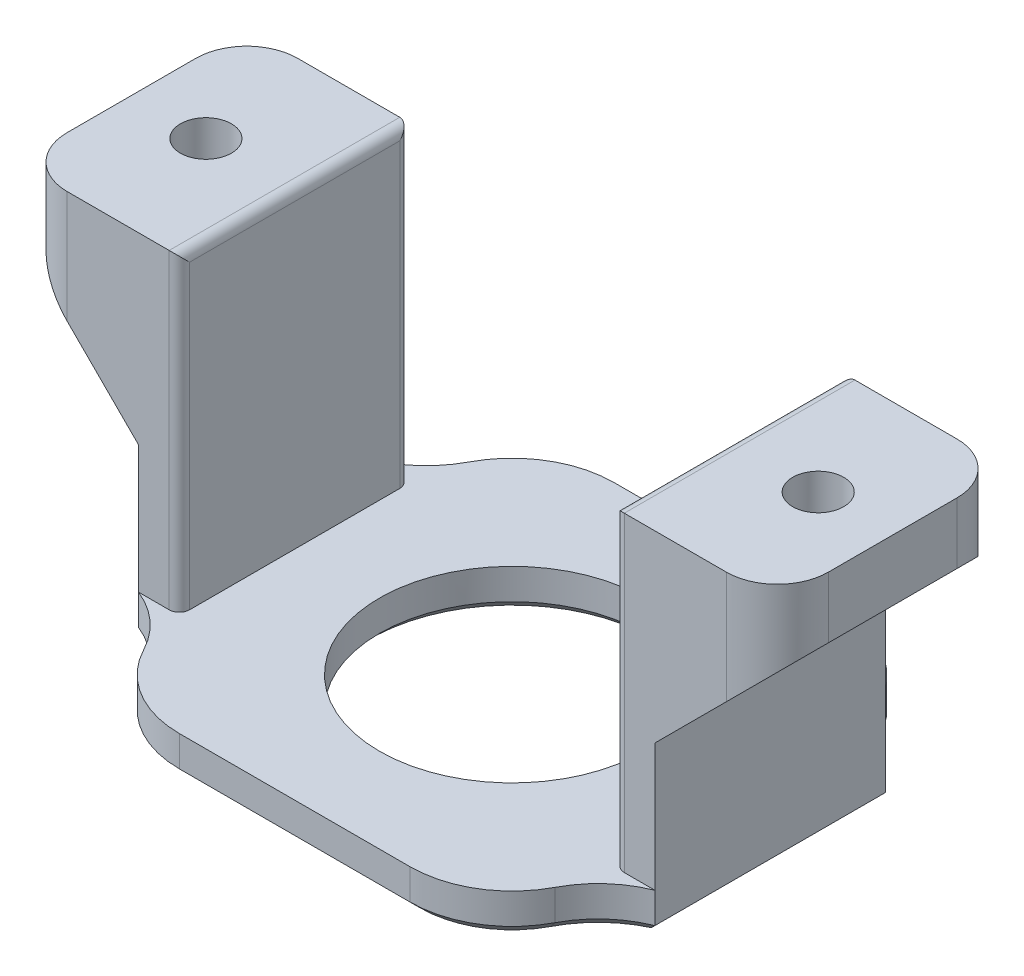
from build123d import *

# Parameters (mm, degrees)
SKETCH_1_W            = 42.6
SKETCH_1_H            = 42.6
EXTRUDE_1_DEPTH       = 4
SKETCH_2_R            = 13
CUT_EXTRUDE_1_DEPTH   = 6
FILLET_1_R            = 10
SKETCH_3_W            = 4
SKETCH_3_H            = 22.6
EXTRUDE_2_DEPTH       = 34.5
FILLET_2_R            = 10
SKETCH_4_W            = 12
SKETCH_4_H            = 22.6
EXTRUDE_3_DEPTH       = 6
FILLET_3_R            = 5
FILLET_4_R            = 1
CHAMFER_3_SIZE        = 1
SKETCH_5_R            = 2.5
CUT_EXTRUDE_2_DEPTH   = 56.092921505
CHAMFER_START         = -9.101924
CHAMFER_4_DEPTH       = 6.602294476
CHAMFER_START_2       = 2.5000001
CHAMFER_4_2_DEPTH     = 6.6019239
CHAMFER_START_3       = -2.499629524
CHAMFER_4_3_DEPTH     = 4.999629624
CHAMFER_START_4       = -11.3
CHAMFER_4_4_DEPTH     = 2.198076
CHAMFER_START_5       = 9.101924
CHAMFER_4_5_DEPTH     = 2.198076
CHAMFER_START_6       = 16.5
CHAMFER_4_6_OUTLINE_R = 2.5
CHAMFER_4_6_DEPTH     = 12
SKETCH_6_R            = 4.2
CUT_EXTRUDE_5_DEPTH   = 28


with BuildPart() as part:
    # Эскиз1 → Бобышка-Вытянуть1 (new body)
    with BuildSketch(Plane(origin=(0, 0, 0), x_dir=(1, 0, 0), z_dir=(0, 1, 0))):
        Rectangle(SKETCH_1_W, SKETCH_1_H)
    extrude(amount=EXTRUDE_1_DEPTH)

    # Эскиз2 → Вырез-Вытянуть1 (cut)
    with BuildSketch(Plane(origin=(0, 4, 0), x_dir=(1, 0, 0), z_dir=(0, 1, 0))):
        with Locations(Location((0, 0, 0), (0, 0, 270))):
            Circle(SKETCH_2_R)
    extrude(amount=-CUT_EXTRUDE_1_DEPTH, mode=Mode.SUBTRACT)

    # Скругление1
    fillet_1_edges = [part.edges().sort_by_distance(p)[0] for p in [
        (21.3, 2, 21.3),
        (-21.3, 2, 21.3),
        (-21.3, 2, -21.3),
        (21.3, 2, -21.3),
    ]]
    fillet(fillet_1_edges, radius=FILLET_1_R)

    # Эскиз3 → Бобышка-Вытянуть2 (add)
    with BuildSketch(Plane(origin=(0, 0, 0), x_dir=(1, 0, 0), z_dir=(0, 1, 0))):
        with Locations((-23.3, 0)):
            Rectangle(SKETCH_3_W, SKETCH_3_H)
        with Locations((23.3, 0)):
            Rectangle(SKETCH_3_W, SKETCH_3_H)
    extrude(amount=EXTRUDE_2_DEPTH)

    # Скругление2
    # the kernel refuses this fillet: 10 mm, written as the material it adds along each edge
    with BuildSketch(Plane(origin=(21.3, 0, -11.3), x_dir=(-0.23904572186687842, 0, -0.9710083124552246), z_dir=(0, 1, 0)), Plane(origin=(-21.3, 0, 11.3), x_dir=(0.2390457218668792, 0, 0.9710083124552243), z_dir=(0, 1, 0))) as fillet_2_piece_1:
        with BuildLine():
            CenterArc((7.171371656, -9.710083125), FILLET_2_R, 103.83022495, 40.535802111)
            Line((-0.956182887, -3.88403325), (0, 0))
            ThreePointArc((0, 0), (2.390457219, -0.289916875), (4.780914437, 0))
        make_face()
    extrude(amount=4)
    with BuildSketch(Plane(origin=(-21.3, 0, -11.3), x_dir=(0.23904572186687842, 0, -0.9710083124552246), z_dir=(0, 1, 0)), Plane(origin=(21.3, 0, 11.3), x_dir=(-0.2390457218668792, 0, 0.9710083124552243), z_dir=(0, 1, 0))) as fillet_2_piece_2:
        with BuildLine():
            CenterArc((7.171371656, 9.710083125), FILLET_2_R, 215.633972939, 40.535802111)
            Line((-0.956182887, 3.88403325), (0, 0))
            ThreePointArc((0, 0), (2.390457219, 0.289916875), (4.780914437, 0))
        make_face()
    extrude(amount=4)

    # Эскиз4 → Бобышка-Вытянуть3 (add)
    with BuildSketch(Plane(origin=(0, 34.5, 0), x_dir=(1, 0, 0), z_dir=(0, 1, 0))):
        with Locations((-31.3, 0)):
            Rectangle(SKETCH_4_W, SKETCH_4_H)
        with Locations((31.3, 0)):
            Rectangle(SKETCH_4_W, SKETCH_4_H)
    extrude(amount=-EXTRUDE_3_DEPTH)

    # Скругление3
    fillet_3_edges = [part.edges().sort_by_distance(p)[0] for p in [
        (37.3, 31.5, -11.3),
        (37.3, 31.5, 11.3),
        (-37.3, 31.5, 11.3),
        (-37.3, 31.5, -11.3),
    ]]
    fillet(fillet_3_edges, radius=FILLET_3_R)

    # Скругление4
    fillet_4_edges = [part.edges().sort_by_distance(p)[0] for p in [
        (21.3, 19.25, -11.3),
        (21.3, 19.25, 11.3),
        (21.3, 34.5, 0),
        (-21.3, 19.25, 11.3),
        (-21.3, 19.25, -11.3),
        (-21.3, 34.5, 0),
    ]]
    fillet(fillet_4_edges, radius=FILLET_4_R)

    # Фаска3
    chamfer_3_edges = [part.edges().sort_by_distance(p)[0] for p in [
        (0, 0, -13),
        (0, 0, 21.3),
        (0, 0, -21.3),
        (16.475757114, 0, -19.856374133),
        (-16.475757114, 0, 19.856374133),
        (25.3, 0, 0),
        (-25.3, 0, 0),
        (-16.475757114, 0, -19.856374133),
        (16.475757114, 0, 19.856374133),
        (22.313691772, 0, -13.16154043),
        (-22.313691772, 0, -13.16154043),
        (-22.313691772, 0, 13.16154043),
        (22.313691772, 0, 13.16154043),
    ]]
    chamfer(chamfer_3_edges, length=CHAMFER_3_SIZE)

    # Эскиз5 → Вырез-Вытянуть2 (cut, through all)
    with BuildSketch(Plane(origin=(0, 34.5, 0), x_dir=(1, 0, 0), z_dir=(0, 1, 0))):
        with Locations(Location((30, 0, 0), (0, 0, 270))):
            Circle(SKETCH_5_R)
        with Locations(Location((-30, 0, 0), (0, 0, 90))):
            Circle(SKETCH_5_R)
    extrude(amount=-CUT_EXTRUDE_2_DEPTH, mode=Mode.SUBTRACT)

    # Фаска4: read off the stored shape, not the designer's step
    # Фаска4 outline → Фаска4 (add)
    with BuildSketch(Plane.XY.offset(CHAMFER_START)):
        Polygon((-37.3, 28.5), (-25.3, 16.5), (-25.3, 28.5), align=None)
        Polygon((25.3, 28.5), (25.3, 16.5), (37.3, 28.5), align=None)
    extrude(amount=CHAMFER_4_DEPTH)

    # Chamfer 4 2 outline → Chamfer 4 2 (add)
    with BuildSketch(Plane.XY.offset(CHAMFER_START_2)):
        Polygon((-37.3, 28.5), (-25.3, 16.5), (-25.3, 28.5), align=None)
        Polygon((25.3, 28.5), (25.3, 16.5), (37.3, 28.5), align=None)
    extrude(amount=CHAMFER_4_2_DEPTH)

    # Chamfer 4 3 outline → Chamfer 4 3 (add)
    with BuildSketch(Plane.XY.offset(CHAMFER_START_3)):
        Polygon((-37.3, 28.5), (-25.3, 16.5), (-25.3, 28.5), align=None)
        Polygon((25.3, 28.5), (25.3, 16.5), (37.3, 28.5), align=None)
    extrude(amount=CHAMFER_4_3_DEPTH)

    # Chamfer 4 4 outline → Chamfer 4 4 (add)
    with BuildSketch(Plane.XY.offset(CHAMFER_START_4)):
        Polygon((-37.3, 28.5), (-25.3, 16.5), (-25.3, 28.5), align=None)
        Polygon((25.3, 28.5), (25.3, 16.5), (37.3, 28.5), align=None)
    extrude(amount=CHAMFER_4_4_DEPTH)

    # Chamfer 4 5 outline → Chamfer 4 5 (add)
    with BuildSketch(Plane.XY.offset(CHAMFER_START_5)):
        Polygon((-37.3, 28.5), (-25.3, 16.5), (-25.3, 28.5), align=None)
        Polygon((25.3, 28.5), (25.3, 16.5), (37.3, 28.5), align=None)
    extrude(amount=CHAMFER_4_5_DEPTH)

    # Chamfer 4 6 outline → Chamfer 4 6 (cut)
    with BuildSketch(Plane(origin=(0, 0, 0), x_dir=(1, 0, 0), z_dir=(0, 1, 0)).offset(CHAMFER_START_6)):
        with BuildLine():
            Line((37.299999999, -11.3), (37.3, -6.3))
            ThreePointArc((37.3, -6.3), (35.835533906, -9.835533906), (32.3, -11.3))
            Line((32.3, -11.3), (37.299999999, -11.3))
        make_face()
        with BuildLine():
            ThreePointArc((32.3, 11.3), (35.835533906, 9.835533906), (37.3, 6.3))
            Line((37.3, 6.3), (37.299999999, 11.3))
            Line((37.299999999, 11.3), (32.3, 11.3))
        make_face()
        with BuildLine():
            Line((-37.3, -11.3), (-32.3, -11.3))
            ThreePointArc((-32.3, -11.3), (-35.835533906, -9.835533906), (-37.3, -6.3))
            Line((-37.3, -6.3), (-37.3, -11.3))
        make_face()
        with BuildLine():
            ThreePointArc((-37.3, 6.3), (-35.835533906, 9.835533906), (-32.3, 11.3))
            Line((-32.3, 11.3), (-37.3, 11.3))
            Line((-37.3, 11.3), (-37.3, 6.3))
        make_face()
        with Locations((-30, 0)):
            Circle(CHAMFER_4_6_OUTLINE_R)
        with Locations((30, 0)):
            Circle(CHAMFER_4_6_OUTLINE_R)
    extrude(amount=CHAMFER_4_6_DEPTH, mode=Mode.SUBTRACT)

    # Эскиз6 → Вырез-Вытянуть5 (cut)
    with BuildSketch(Plane.XZ):
        with Locations(Location((30, 0, 0), (0, 0, 270))):
            Circle(SKETCH_6_R)
        with Locations((-30, 0)):
            Circle(SKETCH_6_R)
    extrude(amount=-CUT_EXTRUDE_5_DEPTH, mode=Mode.SUBTRACT)

    # Фаска5
    # the kernel refuses this chamfer: 2 mm, written as the material it takes off along each edge
    with BuildSketch(Plane(origin=(30, 28, 0), x_dir=(1, 0, 0), z_dir=(0, 0, -1))) as chamfer_5_piece_1_section:
        with BuildLine():
            Line((4.556568542, 0.056568542), (2.443431458, -2.056568542))
            Line((2.443431458, -2.056568542), (2.403431458, -2.056568542))
            ThreePointArc((2.403431458, -2.056568542), (2.46, -1.028284271), (2.46, 0))
            Line((2.46, 0), (2.5, 0.04))
            ThreePointArc((2.5, 0.04), (3.528284271, 0.04), (4.556568542, 0.096568542))
            Line((4.556568542, 0.096568542), (4.556568542, 0.056568542))
        make_face()
    chamfer_5_piece_1 = revolve(axis=Axis((30, 28, 0), (0, -1, 0)), mode=Mode.PRIVATE)
    chamfer_5_piece_1 = chamfer_5_piece_1 & Plane(origin=(30, 28, 0), x_dir=(0, 0, -1), z_dir=(0, -1, 0)) * Cylinder(4.2, 19, mode=Mode.PRIVATE)
    add(chamfer_5_piece_1, mode=Mode.SUBTRACT)
    with BuildSketch(Plane(origin=(-30, 28, 0), x_dir=(1, 0, 0), z_dir=(0, 0, -1))) as chamfer_5_piece_2_section:
        with BuildLine():
            Line((2.443431458, -2.056568542), (4.556568542, 0.056568542))
            Line((4.556568542, 0.056568542), (4.556568542, 0.096568542))
            ThreePointArc((4.556568542, 0.096568542), (3.528284271, 0.04), (2.5, 0.04))
            Line((2.5, 0.04), (2.46, 0))
            ThreePointArc((2.46, 0), (2.46, -1.028284271), (2.403431458, -2.056568542))
            Line((2.403431458, -2.056568542), (2.443431458, -2.056568542))
        make_face()
    chamfer_5_piece_2 = revolve(axis=Axis((-30, 28, 0), (0, -1, 0)), mode=Mode.PRIVATE)
    chamfer_5_piece_2 = chamfer_5_piece_2 & Plane(origin=(-30, 28, 0), x_dir=(1, 0, 0), z_dir=(0, -1, 0)) * Cylinder(4.2, 19, mode=Mode.PRIVATE)
    add(chamfer_5_piece_2, mode=Mode.SUBTRACT)


solid = part.part
